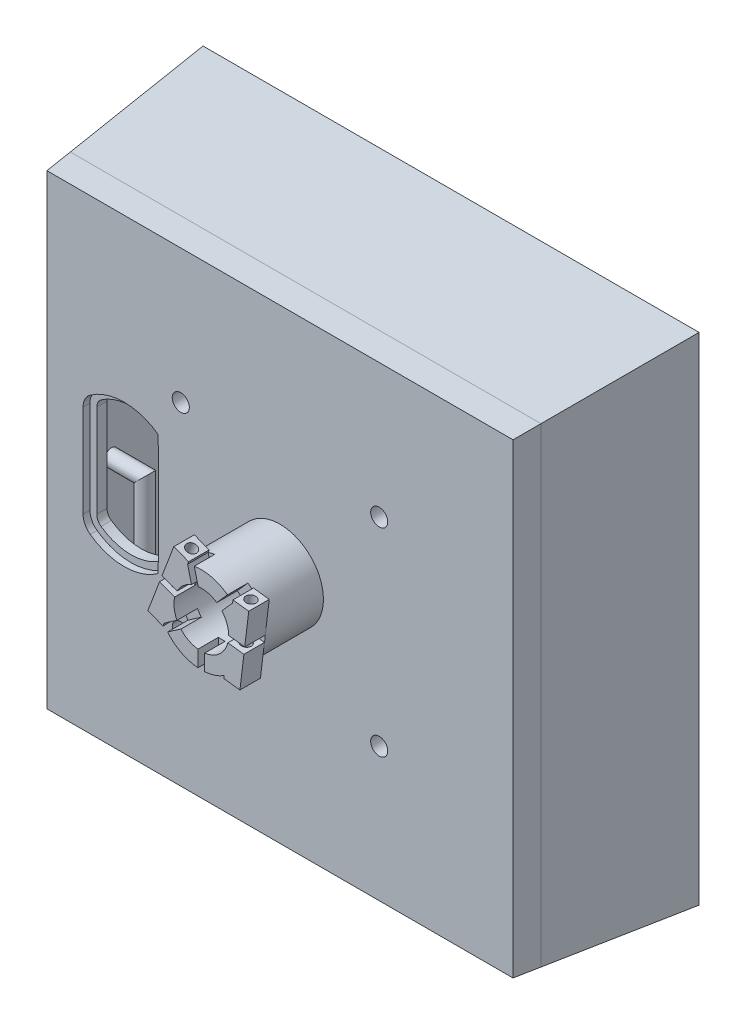
from build123d import *

# Parameters (mm, degrees)
SKETCH11_W                = 145
SKETCH11_H                = 145
BOSS_EXTRUDE5_DEPTH       = 50
CHAMFER1_SIZE             = 50
CHAMFER1_SIZE_2           = 4.374433176
SHELL1_T                  = 5
SKETCH3_R                 = 12.7
SKETCH3_R_2               = 2.5
CUT_EXTRUDE3_DEPTH        = 5
BOSS_EXTRUDE6_START       = -28
SKETCH5_R                 = 12.7
SKETCH5_R_2               = 8
BOSS_EXTRUDE6_DEPTH       = 28
BOSS_EXTRUDE8_REACH       = 219.667
SKETCH8_W                 = 20
SKETCH8_H                 = 20
CUT_EXTRUDE4_REACH        = 219.667
SKETCH13_R                = 6
SKETCH17_R                = 1.85
SKETCH17_R_2              = 1.45
CUT_EXTRUDE5_DEPTH        = 217.041662649
SKETCH18_R                = 3.25
CUT_EXTRUDE6_DEPTH        = 3
SWEEP1_PROFILE_R          = 2.25
SKETCH19_R                = 3.25
SKETCH19_R_2              = 1.45
SKETCH19_R_3              = 1.573637882
SKETCH19_R_4              = 1.85
BOSS_EXTRUDE12_DEPTH      = 3
CUT_EXTRUDE7_DEPTH        = 5
FILLET1_R                 = 3
CUT_EXTRUDE10_DEPTH       = 2
CUT_EXTRUDE20_DEPTH       = 6
CUT_EXTRUDE21_DEPTH       = 174.710002108
CUT_EXTRUDE21_DEPTH_BACK  = 174.710002108
SKETCH46_R                = 1.5
BOSS_EXTRUDE15_REACH      = 177.348
BOSS_EXTRUDE15_END_RADIUS = 12.7
BOSS_EXTRUDE15_START      = -2
SKETCH47_W                = 4.723314774
SKETCH47_H                = 6
SKETCH47_R                = 1.5
BOSS_EXTRUDE19_REACH      = 182.368
BOSS_EXTRUDE19_START      = -2
SKETCH49_W                = 4.645456277
SKETCH49_H                = 6
SKETCH49_R                = 1.5
CUT_EXTRUDE24_DEPTH       = 160.368239054
CUT_EXTRUDE24_DEPTH_BACK  = 160.368239054
SKETCH51_R                = 1.5
BOSS_EXTRUDE20_REACH      = 167.437
BOSS_EXTRUDE20_START      = -2
SKETCH52_W                = 4.645456277
SKETCH52_H                = 6
SKETCH52_R                = 1.5
BOSS_EXTRUDE21_REACH      = 160.76
BOSS_EXTRUDE21_START      = -2
SKETCH53_W                = 4.723314774
SKETCH53_H                = 6
SKETCH53_R                = 1.5


# Read off the part's stored shape, not the designer's step: Split2
with BuildPart() as part:
    # Sketch11 → Boss-Extrude5 (new body)
    with BuildSketch(Plane(origin=(0, 0, 0), x_dir=(0, 1, 0), z_dir=(0, 0, 1))):
        with Locations((72.5, -72.5)):
            Rectangle(SKETCH11_W, SKETCH11_H)
    extrude(amount=BOSS_EXTRUDE5_DEPTH)

    # Chamfer1
    # the kernel refuses this chamfer: 50, 4.374433176 mm, written as the material it takes off along each edge
    with BuildSketch(Plane(origin=(0, -129.981703992, 50), x_dir=(-0.0033526157940331927, 0, -0.9999943799678764), z_dir=(0, 1, 0)), Plane(origin=(-129.981703992, 145, 50), x_dir=(0, 0.0033526157940330487, -0.9999943799678764), z_dir=(1, 0, 0)), Plane(origin=(145, 274.981703992, 50), x_dir=(0.0033526157940330487, 0, -0.9999943799678764), z_dir=(0, -1, 0)), Plane(origin=(274.981703992, 0, 50), x_dir=(0, -0.0033526157940331884, -0.9999943799678764), z_dir=(-1, 0, 0))) as chamfer1_piece_1:
        Polygon((CHAMFER1_SIZE * 0.999994379968, -CHAMFER1_SIZE * 0.00335261579403), (-CHAMFER1_SIZE_2 * 0.00335261579426, -CHAMFER1_SIZE_2 * 0.999994380036), (0, 0), align=None)
    extrude(amount=404.963407984, mode=Mode.SUBTRACT)

    # Shell1 (no face opened: a closed hollow body)
    add(offset(amount=-SHELL1_T, mode=Mode.PRIVATE), mode=Mode.SUBTRACT)

    # Sketch3 → Cut-Extrude3 (cut)
    with BuildSketch(Plane.XY.offset(50)):
        with Locations((72.5, 72.5)):
            Circle(SKETCH3_R)
        with Locations((43.5, 101.5)):
            Circle(SKETCH3_R_2)
        with Locations((101.5, 43.5)):
            Circle(SKETCH3_R_2)
        with Locations((101.5, 101.5)):
            Circle(SKETCH3_R_2)
        with Locations((43.5, 43.5)):
            Circle(SKETCH3_R_2)
    extrude(amount=-CUT_EXTRUDE3_DEPTH, mode=Mode.SUBTRACT)

    # Sketch5 → Boss-Extrude6 (add)
    with BuildSketch(Plane(origin=(0, 0, 45), x_dir=(1, 0, 0), z_dir=(0, 0, -1)).offset(BOSS_EXTRUDE6_START)):
        with Locations(Location((72.5, -72.5, 0), (0, 0, 180))):
            Circle(SKETCH5_R)
        with Locations(Location((72.5, -72.5, 0), (0, 0, 180))):
            Circle(SKETCH5_R_2, mode=Mode.SUBTRACT)
    extrude(amount=BOSS_EXTRUDE6_DEPTH)

    # Boss-Extrude8: up to this plane
    boss_extrude8_end = Plane(origin=(0, 4.374433176, 50), z_dir=(0, -0.9961946980917459, 0.08715574274765493))
    # Sketch8 → Boss-Extrude8 (add, up to the surface)
    with BuildSketch(Plane(origin=(0, 0, 0), x_dir=(-1, 0, 0), z_dir=(0, 1, 0)), mode=Mode.PRIVATE) as boss_extrude8_sk1:
        with Locations((-86.9, 15)):
            Rectangle(SKETCH8_W, SKETCH8_H)
    boss_extrude8_tool1 = split(extrude(boss_extrude8_sk1.sketch, amount=BOSS_EXTRUDE8_REACH, mode=Mode.PRIVATE), bisect_by=boss_extrude8_end, keep=Keep.BOTH, mode=Mode.PRIVATE)
    add(boss_extrude8_tool1.solids().sort_by_distance((86.9, 0, 15))[0])

    # Cut-Extrude4: up to this plane
    cut_extrude4_end = Plane(origin=(0, 9.355406667, 49.564221286), z_dir=(0, -0.9961946980917459, 0.08715574274765493))
    # Sketch13 → Cut-Extrude4 (cut, up to the surface)
    with BuildSketch(Plane.XZ, mode=Mode.PRIVATE) as cut_extrude4_sk1:
        with Locations(Location((86.9, 15, 0), (0, 0, 270))):
            Circle(SKETCH13_R)
    cut_extrude4_tool1 = split(extrude(cut_extrude4_sk1.sketch, amount=-CUT_EXTRUDE4_REACH, mode=Mode.PRIVATE), bisect_by=cut_extrude4_end, keep=Keep.BOTH, mode=Mode.PRIVATE)
    add(cut_extrude4_tool1.solids().sort_by_distance((86.9, 0, 15))[0], mode=Mode.SUBTRACT)

    # Sketch17 → Cut-Extrude5 (cut, through all)
    with BuildSketch(Plane.XY.offset(5)):
        with Locations((129.107923495, 67.5)):
            Circle(SKETCH17_R)
        with Locations((128.943457495, 17.7)):
            Circle(SKETCH17_R)
        with Locations((33.443457495, 17.7)):
            Circle(SKETCH17_R)
        with Locations((33.643457495, 67.5)):
            Circle(SKETCH17_R)
        with Locations((71.956542505, 80.60119497)):
            Circle(SKETCH17_R_2)
        with Locations((13.956542505, 80.60119497)):
            Circle(SKETCH17_R_2)
        with Locations((13.956542505, 129.60119497)):
            Circle(SKETCH17_R_2)
        with Locations((71.956542505, 129.60119497)):
            Circle(SKETCH17_R_2)
    extrude(amount=-CUT_EXTRUDE5_DEPTH, mode=Mode.SUBTRACT)

    # Sketch18 → Cut-Extrude6 (cut)
    with BuildSketch(Plane(origin=(0, 0, 0), x_dir=(1, 0, 0), z_dir=(0, 0, -1))):
        with Locations(Location((71.956542505, -129.60119497, 0), (0, 0, 180))):
            Circle(SKETCH18_R)
        with Locations(Location((13.956542505, -80.60119497, 0), (0, 0, 180))):
            Circle(SKETCH18_R)
        with Locations(Location((13.956542505, -129.60119497, 0), (0, 0, 180))):
            Circle(SKETCH18_R)
        with Locations(Location((71.956542505, -80.60119497, 0), (0, 0, 180))):
            Circle(SKETCH18_R)
        with Locations(Location((33.643457495, -67.5, 0), (0, 0, 180))):
            Circle(SKETCH18_R)
        with Locations(Location((129.107923495, -67.5, 0), (0, 0, 180))):
            Circle(SKETCH18_R)
        with Locations(Location((128.943457495, -17.7, 0), (0, 0, 180))):
            Circle(SKETCH18_R)
        with Locations(Location((33.443457495, -17.7, 0), (0, 0, 180))):
            Circle(SKETCH18_R)
    extrude(amount=-CUT_EXTRUDE6_DEPTH, mode=Mode.SUBTRACT)

    # Sweep1: sweep along a path in Sketch20
    with BuildLine(Plane.XY.offset(35)) as sweep1_path:
        Line((18, 82.5), (5.5, 82.5))
        Line((5.5, 82.5), (5.5, 62.5))
        Line((5.5, 62.5), (18, 62.5))
        Line((18, 62.5), (18, 28))
        Line((18, 28), (5.5, 15.5))
        Line((5.5, 15.5), (5.5, 5.5))
        Line((5.5, 5.5), (15.5, 5.5))
        Line((15.5, 5.5), (28, 18))
        Line((28, 18), (62.5, 18))
        Line((62.5, 18), (62.5, 5.5))
        Line((62.5, 5.5), (82.5, 5.5))
        Line((82.5, 5.5), (82.5, 18))
        Line((82.5, 18), (117, 18))
        Line((117, 18), (129.5, 5.5))
        Line((129.5, 5.5), (139.5, 5.5))
        Line((139.5, 5.5), (139.5, 15.5))
        Line((139.5, 15.5), (127, 28))
        Line((127, 28), (127, 62.5))
        Line((127, 62.5), (139.5, 62.5))
        Line((139.5, 62.5), (139.5, 82.5))
        Line((139.5, 82.5), (127, 82.5))
        Line((127, 82.5), (127, 117))
        Line((127, 117), (139.5, 129.5))
        Line((139.5, 129.5), (139.5, 139.5))
        Line((139.5, 139.5), (129.5, 139.5))
        Line((129.5, 139.5), (117, 127))
        Line((117, 127), (82.5, 127))
        Line((82.5, 127), (82.5, 139.5))
        Line((82.5, 139.5), (62.5, 139.5))
        Line((62.5, 139.5), (62.5, 127))
        Line((62.5, 127), (28, 127))
        Line((28, 127), (15.5, 139.5))
        Line((15.5, 139.5), (5.5, 139.5))
        Line((5.5, 139.5), (5.5, 129.5))
        Line((5.5, 129.5), (18, 117))
        Line((18, 117), (18, 82.5))
    # Sweep1 profile (on start of the path) → Sweep1 (sweep)
    with BuildSketch(Plane(origin=(18, 82.5, 35), x_dir=(0, 0, -1), z_dir=(-1, 0, 0))):
        Circle(SWEEP1_PROFILE_R)
    sweep(path=sweep1_path.line, transition=Transition.RIGHT)

    # Sketch19 → Boss-Extrude12 (add)
    # profile 1 of 8: a face of its own
    with BuildSketch(Plane.XY.offset(5)):
        with Locations(Location((13.956542505, 129.60119497, 0), (0, 0, 180))):
            Circle(SKETCH19_R)
        with Locations((13.956542505, 129.60119497)):
            Circle(SKETCH19_R_2, mode=Mode.SUBTRACT)
    # profile 2 of 8: a face of its own
    with BuildSketch(Plane.XY.offset(5)):
        with Locations(Location((71.956542505, 129.60119497, 0), (0, 0, 180))):
            Circle(SKETCH19_R)
        with Locations((71.956542505, 129.60119497)):
            Circle(SKETCH19_R_3, mode=Mode.SUBTRACT)
    # profile 3 of 8: a face of its own
    with BuildSketch(Plane.XY.offset(5)):
        with Locations(Location((71.956542505, 80.60119497, 0), (0, 0, 180))):
            Circle(SKETCH19_R)
        with Locations((71.956542505, 80.60119497)):
            Circle(SKETCH19_R_2, mode=Mode.SUBTRACT)
    # profile 4 of 8: a face of its own
    with BuildSketch(Plane.XY.offset(5)):
        with Locations(Location((13.956542505, 80.60119497, 0), (0, 0, 180))):
            Circle(SKETCH19_R)
        with Locations((13.956542505, 80.60119497)):
            Circle(SKETCH19_R_2, mode=Mode.SUBTRACT)
    # profile 5 of 8: a face of its own
    with BuildSketch(Plane.XY.offset(5)):
        with Locations(Location((33.643457495, 67.5, 0), (0, 0, 180))):
            Circle(SKETCH19_R)
        with Locations((33.643457495, 67.5)):
            Circle(SKETCH19_R_4, mode=Mode.SUBTRACT)
    # profile 6 of 8: a face of its own
    with BuildSketch(Plane.XY.offset(5)):
        with Locations(Location((33.443457495, 17.7, 0), (0, 0, 180))):
            Circle(SKETCH19_R)
        with Locations((33.443457495, 17.7)):
            Circle(SKETCH19_R_4, mode=Mode.SUBTRACT)
    # profile 7 of 8: a face of its own
    with BuildSketch(Plane.XY.offset(5)):
        with Locations(Location((128.943457495, 17.7, 0), (0, 0, 180))):
            Circle(SKETCH19_R)
        with Locations((128.943457495, 17.7)):
            Circle(SKETCH19_R_4, mode=Mode.SUBTRACT)
    # profile 8 of 8: a face of its own
    with BuildSketch(Plane.XY.offset(5)):
        with Locations(Location((129.107923495, 67.5, 0), (0, 0, 180))):
            Circle(SKETCH19_R)
        with Locations((129.107923495, 67.5)):
            Circle(SKETCH19_R_4, mode=Mode.SUBTRACT)
    extrude(amount=BOSS_EXTRUDE12_DEPTH)


with BuildPart() as body_2:
    # Split1: the piece on the far side of the plane
    add(part.part)
    split(bisect_by=Plane.XY.offset(42.5), keep=Keep.BOTTOM)


with BuildPart() as part_1:
    add(part.part)

    # Split1
    split(bisect_by=Plane.XY.offset(42.5), keep=Keep.TOP)


with BuildPart() as body_3:
    # Split2: the piece on the far side of the plane
    add(part_1.part)
    split(bisect_by=Plane.XY.offset(50), keep=Keep.BOTTOM)

    # Sketch21 → Cut-Extrude7 (cut)
    with BuildSketch(Plane.XY.offset(50)):
        with BuildLine():
            Line((16.94, 57.5), (16.94, 87.5))
            ThreePointArc((16.94, 87.5), (26.94, 91.319660113), (36.94, 87.5))
            Line((36.94, 87.5), (36.94, 57.5))
            ThreePointArc((36.94, 57.5), (26.94, 53.680339887), (16.94, 57.5))
        make_face()
    extrude(amount=-CUT_EXTRUDE7_DEPTH, mode=Mode.SUBTRACT)

    # Fillet1
    fillet1_edges = [body_3.edges().sort_by_distance(p)[0] for p in [
        (36.94, 57.5, 47.5),
        (16.94, 57.5, 47.5),
        (16.94, 87.5, 47.5),
        (36.94, 87.5, 47.5),
    ]]
    fillet(fillet1_edges, radius=FILLET1_R)

    # Sketch24 → Cut-Extrude10 (cut)
    with BuildSketch(Plane.XY.offset(50)):
        with BuildLine():
            Line((36.94, 86.066454457), (36.94, 58.933545543))
            Line((36.94, 58.933545543), (36.856666667, 54.872381232))
            ThreePointArc((36.856666667, 54.872381232), (26.94, 51.680339887), (17.023333333, 54.872381232))
            ThreePointArc((17.023333333, 54.872381232), (15.491217395, 56.65136822), (14.94, 58.933545543))
            Line((14.94, 58.933545543), (14.94, 86.066454457))
            ThreePointArc((14.94, 86.066454457), (15.491217395, 88.34863178), (17.023333333, 90.127618768))
            ThreePointArc((17.023333333, 90.127618768), (26.94, 93.319660113), (36.856666667, 90.127618768))
            Line((36.856666667, 90.127618768), (36.94, 86.066454457))
        make_face()
    extrude(amount=-CUT_EXTRUDE10_DEPTH, mode=Mode.SUBTRACT)


with BuildPart() as part_2:
    add(part_1.part)

    # Split2
    split(bisect_by=Plane.XY.offset(50), keep=Keep.TOP)

    # Sketch45 → Cut-Extrude20 (cut)
    with BuildSketch(Plane.XY.offset(73)):
        with BuildLine():
            Line((71.5, 64.562746067), (71.5, 59.839431292))
            ThreePointArc((71.5, 59.839431292), (72.5, 59.8), (73.5, 59.839431292))
            Line((73.5, 59.839431292), (73.5, 64.562746067))
            ThreePointArc((73.5, 64.562746067), (72.5, 64.5), (71.5, 64.562746067))
        make_face()
        with BuildLine():
            Line((62.648707053, 64.48488757), (66.535890087, 67.168077931))
            ThreePointArc((66.535890087, 67.168077931), (65.916177884, 67.955411312), (65.399742915, 68.81403346))
            Line((65.399742915, 68.81403346), (61.512559881, 66.130843099))
            ThreePointArc((61.512559881, 66.130843099), (62.04818239, 65.285465458), (62.648707053, 64.48488757))
        make_face()
        with BuildLine():
            Line((60.307481379, 76.054221387), (64.72389339, 74.379405754))
            ThreePointArc((64.72389339, 74.379405754), (65.019809122, 75.336678415), (65.433062994, 76.249453473))
            Line((65.433062994, 76.249453473), (61.016650983, 77.924269107))
            ThreePointArc((61.016650983, 77.924269107), (60.625196981, 77.003226984), (60.307481379, 76.054221387))
        make_face()
        with BuildLine():
            Line((68.498797397, 84.553231008), (69.629308379, 79.967203601))
            ThreePointArc((69.629308379, 79.967203601), (70.585224405, 80.267472847), (71.571176591, 80.4458975))
            Line((71.571176591, 80.4458975), (70.440665609, 85.031924907))
            ThreePointArc((70.440665609, 85.031924907), (69.460293744, 84.830863144), (68.498797397, 84.553231008))
        make_face()
        with BuildLine():
            Line((80.1465636, 82.640022934), (77.014578444, 79.104436499))
            ThreePointArc((77.014578444, 79.104436499), (77.804724001, 78.488313892), (78.511656917, 77.778255499))
            Line((78.511656917, 77.778255499), (81.643642073, 81.313841934))
            ThreePointArc((81.643642073, 81.313841934), (80.921249352, 82.006448304), (80.1465636, 82.640022934))
        make_face()
        with BuildLine():
            Line((85.188824212, 71.967327372), (80.499917152, 72.53640825))
            ThreePointArc((80.499917152, 72.53640825), (80.441722766, 71.536133046), (80.258950414, 70.550977558))
            Line((80.258950414, 70.550977558), (84.947857473, 69.98189668))
            ThreePointArc((84.947857473, 69.98189668), (85.107484891, 70.969861211), (85.188824212, 71.967327372))
        make_face()
    extrude(amount=-CUT_EXTRUDE20_DEPTH, mode=Mode.SUBTRACT)

    # Sketch46 → Cut-Extrude21 (cut, two sides: drawn at the far end of the back side and taken through both)
    with BuildSketch(Plane(origin=(9.844323422, 81.111700272, 0), x_dir=(0.9927153457802488, -0.12048336919426347, 0), z_dir=(-0.12048336919426349, -0.9927153457802489, 0)).offset(-CUT_EXTRUDE21_DEPTH_BACK)):
        with Locations((73.535729623, 70)):
            Circle(SKETCH46_R)
    extrude(amount=CUT_EXTRUDE21_DEPTH + CUT_EXTRUDE21_DEPTH_BACK, mode=Mode.SUBTRACT)

    # Boss-Extrude15: up to this cylinder (the profile starts outside it)
    boss_extrude15_end = Plane(origin=(72.5, 72.5, 72.923639), z_dir=(0, 0, -1)) * Cylinder(BOSS_EXTRUDE15_END_RADIUS, 381.096, mode=Mode.PRIVATE)
    # Sketch47 → Boss-Extrude15 (add, up to the surface)
    with BuildSketch(Plane(origin=(8.193701264, 67.511500035, 0), x_dir=(0.9927153457802488, -0.12048336919426347, 0), z_dir=(-0.12048336919426349, -0.9927153457802489, 0)).offset(BOSS_EXTRUDE15_START), mode=Mode.PRIVATE) as boss_extrude15_sk1:
        with Locations((73.535729623, 70)):
            Rectangle(SKETCH47_W, SKETCH47_H)
        with Locations((73.535729623, 70)):
            Circle(SKETCH47_R, mode=Mode.SUBTRACT)
    boss_extrude15_tool1 = extrude(boss_extrude15_sk1.sketch, amount=-BOSS_EXTRUDE15_REACH, mode=Mode.PRIVATE) - boss_extrude15_end
    add(boss_extrude15_tool1.solids().sort_by_distance((81.434715, 60.637098, 72.923639))[0])

    # Sketch49 → Boss-Extrude19 (add, up to next)
    with BuildSketch(Plane(origin=(11.253978842, 92.726469818, 0), x_dir=(-0.9927153457802488, 0.12048336919426347, 0), z_dir=(0.12048336919426349, 0.9927153457802489, 0)).offset(BOSS_EXTRUDE19_START), mode=Mode.PRIVATE) as boss_extrude19_sk1:
        with Locations((-73.574658872, 70)):
            Rectangle(SKETCH49_W, SKETCH49_H)
        with Locations(Location((-73.535729623, 70, 0), (0, 0, 180))):
            Circle(SKETCH49_R, mode=Mode.SUBTRACT)
    boss_extrude19_tool1 = extrude(boss_extrude19_sk1.sketch, amount=-BOSS_EXTRUDE19_REACH, mode=Mode.PRIVATE) - part_2.part
    add(boss_extrude19_tool1.solids().sort_by_distance((81.821226, 82.147224, 70))[0])

    # Sketch51 → Cut-Extrude24 (cut, two sides: drawn at the far end of the back side and taken through both)
    with BuildSketch(Plane(origin=(32.797898504, 86.486554095, 0), x_dir=(-0.9350238597285484, 0.3545848018998104, 0), z_dir=(0.3545848018998104, 0.9350238597285484, 0)).offset(-CUT_EXTRUDE24_DEPTH_BACK)):
        with Locations((-31.782920372, 70)):
            Circle(SKETCH51_R)
    extrude(amount=CUT_EXTRUDE24_DEPTH + CUT_EXTRUDE24_DEPTH_BACK, mode=Mode.SUBTRACT)

    # Sketch52 → Boss-Extrude20 (add, up to next)
    with BuildSketch(Plane(origin=(37.65571029, 99.296380973, 0), x_dir=(-0.9350238597285484, 0.3545848018998104, 0), z_dir=(0.3545848018998104, 0.9350238597285484, 0)).offset(BOSS_EXTRUDE20_START), mode=Mode.PRIVATE) as boss_extrude20_sk1:
        with Locations((-31.743991124, 70)):
            Rectangle(SKETCH52_W, SKETCH52_H)
        with Locations((-31.782920372, 70)):
            Circle(SKETCH52_R, mode=Mode.SUBTRACT)
    boss_extrude20_tool1 = extrude(boss_extrude20_sk1.sketch, amount=-BOSS_EXTRUDE20_REACH, mode=Mode.PRIVATE) - part_2.part
    add(boss_extrude20_tool1.solids().sort_by_distance((68.728785, 85.373699, 70))[0])

    # Sketch53 → Boss-Extrude21 (add, up to next)
    with BuildSketch(Plane(origin=(28.649256322, 75.546774936, 0), x_dir=(0.9350238597285484, -0.3545848018998104, 0), z_dir=(-0.3545848018998104, -0.9350238597285484, 0)).offset(BOSS_EXTRUDE21_START), mode=Mode.PRIVATE) as boss_extrude21_sk1:
        with Locations((31.782920372, 70)):
            Rectangle(SKETCH53_W, SKETCH53_H)
        with Locations(Location((31.782920372, 70, 0), (0, 0, 180))):
            Circle(SKETCH53_R, mode=Mode.SUBTRACT)
    boss_extrude21_tool1 = extrude(boss_extrude21_sk1.sketch, amount=-BOSS_EXTRUDE21_REACH, mode=Mode.PRIVATE) - part_2.part
    add(boss_extrude21_tool1.solids().sort_by_distance((59.076215, 66.147082, 72.923639))[0])


with BuildPart() as body_2_1:
    add(body_2.part)

    # Combine1: union body 3, part
    add(body_3.part)
    add(part_2.part)


with BuildPart() as body_2_2:
    # Split3: the piece on the far side of the plane
    add(body_2_1.part)
    split(bisect_by=Plane.XY.offset(42.5), keep=Keep.BOTTOM)


with BuildPart() as body_2_3:
    add(body_2_1.part)

    # Split3
    split(bisect_by=Plane.XY.offset(42.5), keep=Keep.TOP)


solid = Compound([body_2_2.part, body_2_3.part])
